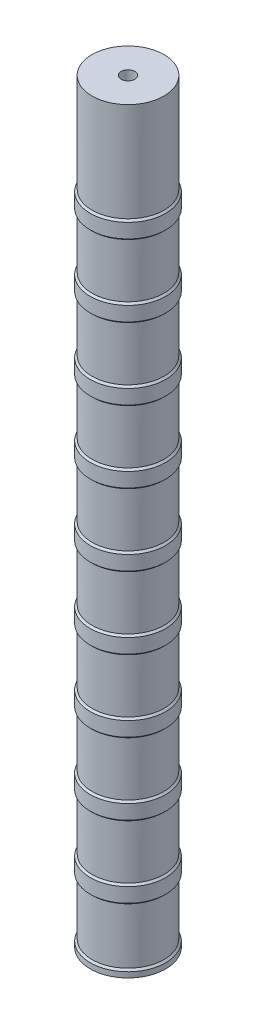
from build123d import *

# Parameters (mm, degrees)
SKETCH_1_R                             = 10
EXTRUDE_1_DEPTH                        = 210
SKETCH_2_R                             = 10.5
EXTRUDE_2_DEPTH                        = 1.5
CHAMFER_1_SIZE                         = 1
PATTERN_LINEAR_1_COUNT                 = 5
PATTERN_LINEAR_1_PITCH                 = 20
CHAMFER_1_OF_PATTERN_LINEAR_1_SIZE     = 1
PATTERN_LINEAR_1_COL_COUNT             = 5
PATTERN_LINEAR_1_COL_PITCH             = 20
CHAMFER_1_OF_PATTERN_LINEAR_1_COL_SIZE = 1
CUT_EXTRUDE_1_DEPTH                    = 211.524345386
CUT_EXTRUDE_1_DEPTH_BACK               = 211.524345386
SKETCH_3_R                             = 1.9
SKETCH_11_R                            = 5.2
CUT_EXTRUDE_2_DEPTH                    = 10
SKETCH_12_R                            = 10.5
SKETCH_12_R_2                          = 5
EXTRUDE_3_DEPTH                        = 1.5
CHAMFER_2_SIZE                         = 0.5


# Some blends are built 0.0001 mm under size
with BuildPart() as part:
    # 草图1 → 凸台-拉伸1 (new body)
    with BuildSketch(Plane(origin=(0, 0, 0), x_dir=(1, 0, 0), z_dir=(0, 1, 0))):
        with Locations(Location((0, 0, 0), (0, 0, 270))):
            Circle(SKETCH_1_R)
    extrude(amount=EXTRUDE_1_DEPTH)

    # 草图2 → 凸台-拉伸2 (add, symmetric)
    with BuildSketch(Plane(origin=(0, 100, 0), x_dir=(-1, 0, 0), z_dir=(0, -1, 0))):
        with Locations(Location((0, 0, 0), (0, 0, 90))):
            Circle(SKETCH_2_R)
    extrude_2 = extrude(amount=EXTRUDE_2_DEPTH, both=True)

    # 倒角1
    # the kernel refuses this chamfer: 1 mm, written as the material it adds along each edge
    with BuildSketch(Plane(origin=(0, 101.5, 0), x_dir=(0, 0, 1), z_dir=(1, 0, 0))) as chamfer_1_piece_1_section:
        Polygon((10 + CHAMFER_1_SIZE, 0), (10, -CHAMFER_1_SIZE), (10, 0), align=None)
    chamfer_1_piece_1 = revolve(axis=Axis((0, 101.5, 0), (0, -1, 0)), mode=Mode.PRIVATE)
    chamfer_1_piece_1 = chamfer_1_piece_1 & Plane(origin=(0, 102.243131565, 0), x_dir=(0, 0, -1), z_dir=(0, -1, 0)) * Cylinder(10.5, 44, mode=Mode.PRIVATE)
    add(chamfer_1_piece_1)
    with BuildSketch(Plane(origin=(0, 98.5, 0), x_dir=(0, 0, 1), z_dir=(1, 0, 0))) as chamfer_1_piece_2_section:
        Polygon((10, CHAMFER_1_SIZE), (10 + CHAMFER_1_SIZE, 0), (10, 0), align=None)
    chamfer_1_piece_2 = revolve(axis=Axis((0, 98.5, 0), (0, -1, 0)), mode=Mode.PRIVATE)
    chamfer_1_piece_2 = chamfer_1_piece_2 & Plane(origin=(0, 97.756868435, 0), x_dir=(0, 0, -1), z_dir=(0, -1, 0)) * Cylinder(10.5, 44, mode=Mode.PRIVATE)
    add(chamfer_1_piece_2)

    # 阵列(线性)1: 凸台-拉伸2 ×5
    with Locations(*[(0, i * PATTERN_LINEAR_1_PITCH, 0) for i in range(1, PATTERN_LINEAR_1_COUNT)]):
        add(extrude_2)

    # 倒角1 of 阵列(线性)1
    # the kernel refuses this chamfer: 1 mm, written as the material it adds along each edge
    with BuildSketch(Plane(origin=(0, 121.5, 0), x_dir=(0, 0, 1), z_dir=(1, 0, 0))) as chamfer_1_of_pattern_linear_1_piece_1_section:
        Polygon((10 + CHAMFER_1_OF_PATTERN_LINEAR_1_SIZE, 0), (10, -CHAMFER_1_OF_PATTERN_LINEAR_1_SIZE), (10, 0), align=None)
    chamfer_1_of_pattern_linear_1_piece_1 = revolve(axis=Axis((0, 121.5, 0), (0, -1, 0)), mode=Mode.PRIVATE)
    chamfer_1_of_pattern_linear_1_piece_1 = chamfer_1_of_pattern_linear_1_piece_1 & Plane(origin=(0, 122.243131565, 0), x_dir=(0, 0, -1), z_dir=(0, -1, 0)) * Cylinder(10.5, 44, mode=Mode.PRIVATE)
    add(chamfer_1_of_pattern_linear_1_piece_1)
    with BuildSketch(Plane(origin=(0, 118.5, 0), x_dir=(0, 0, 1), z_dir=(1, 0, 0))) as chamfer_1_of_pattern_linear_1_piece_2_section:
        Polygon((10, CHAMFER_1_OF_PATTERN_LINEAR_1_SIZE), (10 + CHAMFER_1_OF_PATTERN_LINEAR_1_SIZE, 0), (10, 0), align=None)
    chamfer_1_of_pattern_linear_1_piece_2 = revolve(axis=Axis((0, 118.5, 0), (0, -1, 0)), mode=Mode.PRIVATE)
    chamfer_1_of_pattern_linear_1_piece_2 = chamfer_1_of_pattern_linear_1_piece_2 & Plane(origin=(0, 117.756868435, 0), x_dir=(0, 0, -1), z_dir=(0, -1, 0)) * Cylinder(10.5, 44, mode=Mode.PRIVATE)
    add(chamfer_1_of_pattern_linear_1_piece_2)
    with BuildSketch(Plane(origin=(0, 141.5, 0), x_dir=(0, 0, 1), z_dir=(1, 0, 0))) as chamfer_1_of_pattern_linear_1_piece_3_section:
        Polygon((10 + CHAMFER_1_OF_PATTERN_LINEAR_1_SIZE, 0), (10, -CHAMFER_1_OF_PATTERN_LINEAR_1_SIZE), (10, 0), align=None)
    chamfer_1_of_pattern_linear_1_piece_3 = revolve(axis=Axis((0, 141.5, 0), (0, -1, 0)), mode=Mode.PRIVATE)
    chamfer_1_of_pattern_linear_1_piece_3 = chamfer_1_of_pattern_linear_1_piece_3 & Plane(origin=(0, 142.243131565, 0), x_dir=(0, 0, -1), z_dir=(0, -1, 0)) * Cylinder(10.5, 44, mode=Mode.PRIVATE)
    add(chamfer_1_of_pattern_linear_1_piece_3)
    with BuildSketch(Plane(origin=(0, 138.5, 0), x_dir=(0, 0, 1), z_dir=(1, 0, 0))) as chamfer_1_of_pattern_linear_1_piece_4_section:
        Polygon((10, CHAMFER_1_OF_PATTERN_LINEAR_1_SIZE), (10 + CHAMFER_1_OF_PATTERN_LINEAR_1_SIZE, 0), (10, 0), align=None)
    chamfer_1_of_pattern_linear_1_piece_4 = revolve(axis=Axis((0, 138.5, 0), (0, -1, 0)), mode=Mode.PRIVATE)
    chamfer_1_of_pattern_linear_1_piece_4 = chamfer_1_of_pattern_linear_1_piece_4 & Plane(origin=(0, 137.756868435, 0), x_dir=(0, 0, -1), z_dir=(0, -1, 0)) * Cylinder(10.5, 44, mode=Mode.PRIVATE)
    add(chamfer_1_of_pattern_linear_1_piece_4)
    with BuildSketch(Plane(origin=(0, 161.5, 0), x_dir=(0, 0, 1), z_dir=(1, 0, 0))) as chamfer_1_of_pattern_linear_1_piece_5_section:
        Polygon((10 + CHAMFER_1_OF_PATTERN_LINEAR_1_SIZE, 0), (10, -CHAMFER_1_OF_PATTERN_LINEAR_1_SIZE), (10, 0), align=None)
    chamfer_1_of_pattern_linear_1_piece_5 = revolve(axis=Axis((0, 161.5, 0), (0, -1, 0)), mode=Mode.PRIVATE)
    chamfer_1_of_pattern_linear_1_piece_5 = chamfer_1_of_pattern_linear_1_piece_5 & Plane(origin=(0, 162.243131565, 0), x_dir=(0, 0, -1), z_dir=(0, -1, 0)) * Cylinder(10.5, 44, mode=Mode.PRIVATE)
    add(chamfer_1_of_pattern_linear_1_piece_5)
    with BuildSketch(Plane(origin=(0, 158.5, 0), x_dir=(0, 0, 1), z_dir=(1, 0, 0))) as chamfer_1_of_pattern_linear_1_piece_6_section:
        Polygon((10, CHAMFER_1_OF_PATTERN_LINEAR_1_SIZE), (10 + CHAMFER_1_OF_PATTERN_LINEAR_1_SIZE, 0), (10, 0), align=None)
    chamfer_1_of_pattern_linear_1_piece_6 = revolve(axis=Axis((0, 158.5, 0), (0, -1, 0)), mode=Mode.PRIVATE)
    chamfer_1_of_pattern_linear_1_piece_6 = chamfer_1_of_pattern_linear_1_piece_6 & Plane(origin=(0, 157.756868435, 0), x_dir=(0, 0, -1), z_dir=(0, -1, 0)) * Cylinder(10.5, 44, mode=Mode.PRIVATE)
    add(chamfer_1_of_pattern_linear_1_piece_6)
    with BuildSketch(Plane(origin=(0, 181.5, 0), x_dir=(0, 0, 1), z_dir=(1, 0, 0))) as chamfer_1_of_pattern_linear_1_piece_7_section:
        Polygon((10 + CHAMFER_1_OF_PATTERN_LINEAR_1_SIZE, 0), (10, -CHAMFER_1_OF_PATTERN_LINEAR_1_SIZE), (10, 0), align=None)
    chamfer_1_of_pattern_linear_1_piece_7 = revolve(axis=Axis((0, 181.5, 0), (0, -1, 0)), mode=Mode.PRIVATE)
    chamfer_1_of_pattern_linear_1_piece_7 = chamfer_1_of_pattern_linear_1_piece_7 & Plane(origin=(0, 182.243131565, 0), x_dir=(0, 0, -1), z_dir=(0, -1, 0)) * Cylinder(10.5, 44, mode=Mode.PRIVATE)
    add(chamfer_1_of_pattern_linear_1_piece_7)
    with BuildSketch(Plane(origin=(0, 178.5, 0), x_dir=(0, 0, 1), z_dir=(1, 0, 0))) as chamfer_1_of_pattern_linear_1_piece_8_section:
        Polygon((10, CHAMFER_1_OF_PATTERN_LINEAR_1_SIZE), (10 + CHAMFER_1_OF_PATTERN_LINEAR_1_SIZE, 0), (10, 0), align=None)
    chamfer_1_of_pattern_linear_1_piece_8 = revolve(axis=Axis((0, 178.5, 0), (0, -1, 0)), mode=Mode.PRIVATE)
    chamfer_1_of_pattern_linear_1_piece_8 = chamfer_1_of_pattern_linear_1_piece_8 & Plane(origin=(0, 177.756868435, 0), x_dir=(0, 0, -1), z_dir=(0, -1, 0)) * Cylinder(10.5, 44, mode=Mode.PRIVATE)
    add(chamfer_1_of_pattern_linear_1_piece_8)

    # 阵列(线性)1 col: 凸台-拉伸2 ×5
    with Locations(*[(0, -i * PATTERN_LINEAR_1_COL_PITCH, 0) for i in range(1, PATTERN_LINEAR_1_COL_COUNT)]):
        add(extrude_2)

    # 倒角1 of 阵列(线性)1 col
    # the kernel refuses this chamfer: 1 mm, written as the material it adds along each edge
    with BuildSketch(Plane(origin=(0, 81.5, 0), x_dir=(0, 0, 1), z_dir=(1, 0, 0))) as chamfer_1_of_pattern_linear_1_col_piece_1_section:
        Polygon((10, -CHAMFER_1_OF_PATTERN_LINEAR_1_COL_SIZE), (10 + CHAMFER_1_OF_PATTERN_LINEAR_1_COL_SIZE, 0), (10, 0), align=None)
    chamfer_1_of_pattern_linear_1_col_piece_1 = revolve(axis=Axis((0, 81.5, 0), (0, -1, 0)), mode=Mode.PRIVATE)
    chamfer_1_of_pattern_linear_1_col_piece_1 = chamfer_1_of_pattern_linear_1_col_piece_1 & Plane(origin=(0, 82.243131565, 0), x_dir=(0, 0, -1), z_dir=(0, -1, 0)) * Cylinder(10.5, 44, mode=Mode.PRIVATE)
    add(chamfer_1_of_pattern_linear_1_col_piece_1)
    with BuildSketch(Plane(origin=(0, 78.5, 0), x_dir=(0, 0, 1), z_dir=(1, 0, 0))) as chamfer_1_of_pattern_linear_1_col_piece_2_section:
        Polygon((10 + CHAMFER_1_OF_PATTERN_LINEAR_1_COL_SIZE, 0), (10, CHAMFER_1_OF_PATTERN_LINEAR_1_COL_SIZE), (10, 0), align=None)
    chamfer_1_of_pattern_linear_1_col_piece_2 = revolve(axis=Axis((0, 78.5, 0), (0, -1, 0)), mode=Mode.PRIVATE)
    chamfer_1_of_pattern_linear_1_col_piece_2 = chamfer_1_of_pattern_linear_1_col_piece_2 & Plane(origin=(0, 77.756868435, 0), x_dir=(0, 0, -1), z_dir=(0, -1, 0)) * Cylinder(10.5, 44, mode=Mode.PRIVATE)
    add(chamfer_1_of_pattern_linear_1_col_piece_2)
    with BuildSketch(Plane(origin=(0, 61.5, 0), x_dir=(0, 0, 1), z_dir=(1, 0, 0))) as chamfer_1_of_pattern_linear_1_col_piece_3_section:
        Polygon((10, -CHAMFER_1_OF_PATTERN_LINEAR_1_COL_SIZE), (10 + CHAMFER_1_OF_PATTERN_LINEAR_1_COL_SIZE, 0), (10, 0), align=None)
    chamfer_1_of_pattern_linear_1_col_piece_3 = revolve(axis=Axis((0, 61.5, 0), (0, -1, 0)), mode=Mode.PRIVATE)
    chamfer_1_of_pattern_linear_1_col_piece_3 = chamfer_1_of_pattern_linear_1_col_piece_3 & Plane(origin=(0, 62.243131565, 0), x_dir=(0, 0, -1), z_dir=(0, -1, 0)) * Cylinder(10.5, 44, mode=Mode.PRIVATE)
    add(chamfer_1_of_pattern_linear_1_col_piece_3)
    with BuildSketch(Plane(origin=(0, 58.5, 0), x_dir=(0, 0, 1), z_dir=(1, 0, 0))) as chamfer_1_of_pattern_linear_1_col_piece_4_section:
        Polygon((10 + CHAMFER_1_OF_PATTERN_LINEAR_1_COL_SIZE, 0), (10, CHAMFER_1_OF_PATTERN_LINEAR_1_COL_SIZE), (10, 0), align=None)
    chamfer_1_of_pattern_linear_1_col_piece_4 = revolve(axis=Axis((0, 58.5, 0), (0, -1, 0)), mode=Mode.PRIVATE)
    chamfer_1_of_pattern_linear_1_col_piece_4 = chamfer_1_of_pattern_linear_1_col_piece_4 & Plane(origin=(0, 57.756868435, 0), x_dir=(0, 0, -1), z_dir=(0, -1, 0)) * Cylinder(10.5, 44, mode=Mode.PRIVATE)
    add(chamfer_1_of_pattern_linear_1_col_piece_4)
    with BuildSketch(Plane(origin=(0, 41.5, 0), x_dir=(0, 0, 1), z_dir=(1, 0, 0))) as chamfer_1_of_pattern_linear_1_col_piece_5_section:
        Polygon((10, -CHAMFER_1_OF_PATTERN_LINEAR_1_COL_SIZE), (10 + CHAMFER_1_OF_PATTERN_LINEAR_1_COL_SIZE, 0), (10, 0), align=None)
    chamfer_1_of_pattern_linear_1_col_piece_5 = revolve(axis=Axis((0, 41.5, 0), (0, -1, 0)), mode=Mode.PRIVATE)
    chamfer_1_of_pattern_linear_1_col_piece_5 = chamfer_1_of_pattern_linear_1_col_piece_5 & Plane(origin=(0, 42.243131565, 0), x_dir=(0, 0, -1), z_dir=(0, -1, 0)) * Cylinder(10.5, 44, mode=Mode.PRIVATE)
    add(chamfer_1_of_pattern_linear_1_col_piece_5)
    with BuildSketch(Plane(origin=(0, 38.5, 0), x_dir=(0, 0, 1), z_dir=(1, 0, 0))) as chamfer_1_of_pattern_linear_1_col_piece_6_section:
        Polygon((10 + CHAMFER_1_OF_PATTERN_LINEAR_1_COL_SIZE, 0), (10, CHAMFER_1_OF_PATTERN_LINEAR_1_COL_SIZE), (10, 0), align=None)
    chamfer_1_of_pattern_linear_1_col_piece_6 = revolve(axis=Axis((0, 38.5, 0), (0, -1, 0)), mode=Mode.PRIVATE)
    chamfer_1_of_pattern_linear_1_col_piece_6 = chamfer_1_of_pattern_linear_1_col_piece_6 & Plane(origin=(0, 37.756868435, 0), x_dir=(0, 0, -1), z_dir=(0, -1, 0)) * Cylinder(10.5, 44, mode=Mode.PRIVATE)
    add(chamfer_1_of_pattern_linear_1_col_piece_6)
    with BuildSketch(Plane(origin=(0, 21.5, 0), x_dir=(0, 0, 1), z_dir=(1, 0, 0))) as chamfer_1_of_pattern_linear_1_col_piece_7_section:
        Polygon((10, -CHAMFER_1_OF_PATTERN_LINEAR_1_COL_SIZE), (10 + CHAMFER_1_OF_PATTERN_LINEAR_1_COL_SIZE, 0), (10, 0), align=None)
    chamfer_1_of_pattern_linear_1_col_piece_7 = revolve(axis=Axis((0, 21.5, 0), (0, -1, 0)), mode=Mode.PRIVATE)
    chamfer_1_of_pattern_linear_1_col_piece_7 = chamfer_1_of_pattern_linear_1_col_piece_7 & Plane(origin=(0, 22.243131565, 0), x_dir=(0, 0, -1), z_dir=(0, -1, 0)) * Cylinder(10.5, 44, mode=Mode.PRIVATE)
    add(chamfer_1_of_pattern_linear_1_col_piece_7)
    with BuildSketch(Plane(origin=(0, 18.5, 0), x_dir=(0, 0, 1), z_dir=(1, 0, 0))) as chamfer_1_of_pattern_linear_1_col_piece_8_section:
        Polygon((10 + CHAMFER_1_OF_PATTERN_LINEAR_1_COL_SIZE, 0), (10, CHAMFER_1_OF_PATTERN_LINEAR_1_COL_SIZE), (10, 0), align=None)
    chamfer_1_of_pattern_linear_1_col_piece_8 = revolve(axis=Axis((0, 18.5, 0), (0, -1, 0)), mode=Mode.PRIVATE)
    chamfer_1_of_pattern_linear_1_col_piece_8 = chamfer_1_of_pattern_linear_1_col_piece_8 & Plane(origin=(0, 17.756868435, 0), x_dir=(0, 0, -1), z_dir=(0, -1, 0)) * Cylinder(10.5, 44, mode=Mode.PRIVATE)
    add(chamfer_1_of_pattern_linear_1_col_piece_8)

    # 草图3 → 切除-拉伸1 (cut, two sides: drawn at the far end of the back side and taken through both)
    with BuildSketch(Plane(origin=(0, 210, 0), x_dir=(1, 0, 0), z_dir=(0, 1, 0)).offset(-CUT_EXTRUDE_1_DEPTH_BACK)):
        with Locations(Location((0, 0, 0), (0, 0, 270))):
            Circle(SKETCH_3_R)
    extrude(amount=CUT_EXTRUDE_1_DEPTH + CUT_EXTRUDE_1_DEPTH_BACK, mode=Mode.SUBTRACT)

    # 草图11 → 切除-拉伸2 (cut)
    with BuildSketch(Plane.XZ):
        with Locations(Location((0, 0, 0), (0, 0, 270))):
            Circle(SKETCH_11_R)
    extrude(amount=-CUT_EXTRUDE_2_DEPTH, mode=Mode.SUBTRACT)

    # 草图12 → 凸台-拉伸3 (add)
    with BuildSketch(Plane.XZ):
        with Locations(Location((0, 0, 0), (0, 0, 90))):
            Circle(SKETCH_12_R)
        with Locations(Location((0, 0, 0), (0, 0, 270))):
            Circle(SKETCH_12_R_2, mode=Mode.SUBTRACT)
    extrude(amount=-EXTRUDE_3_DEPTH)

    # 倒角2
    chamfer_2_edges = [part.edges().sort_by_distance(p)[0] for p in [
        (0, 1.5, -10),
    ]]
    chamfer(chamfer_2_edges, length=CHAMFER_2_SIZE - 0.0001)  # a hair under: the kernel refuses the full size


solid = part.part
